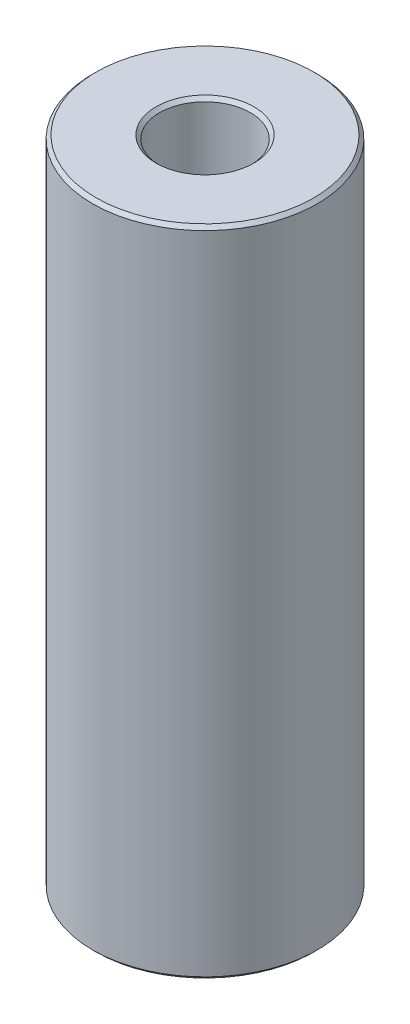
from build123d import *

# Parameters (mm, degrees)
SKETCH1_R           = 55
BOSS_EXTRUDE1_DEPTH = 319.697759108
SKETCH2_R           = 22.254581202
CUT_EXTRUDE1_DEPTH  = 330.023794244
CHAMFER1_SIZE       = 1.687761734


with BuildPart() as part:
    # Sketch1 → Boss-Extrude1 (new body)
    with BuildSketch(Plane(origin=(0, 0, 0), x_dir=(1, 0, 0), z_dir=(0, 1, 0))):
        Circle(SKETCH1_R)
    extrude(amount=BOSS_EXTRUDE1_DEPTH)

    # Sketch2 → Cut-Extrude1 (cut, through all)
    with BuildSketch(Plane(origin=(0, 0, 0), x_dir=(1, 0, 0), z_dir=(0, 1, 0))):
        Circle(SKETCH2_R)
    extrude(amount=CUT_EXTRUDE1_DEPTH, mode=Mode.SUBTRACT)

    # Chamfer1
    chamfer1_edges = [part.edges().sort_by_distance(p)[0] for p in [
        (-22.254581202, 319.697759108, 0),
        (-22.254581202, 0, 0),
        (-55, 0, 0),
        (-55, 319.697759108, 0),
    ]]
    chamfer(chamfer1_edges, length=CHAMFER1_SIZE)


solid = part.part
